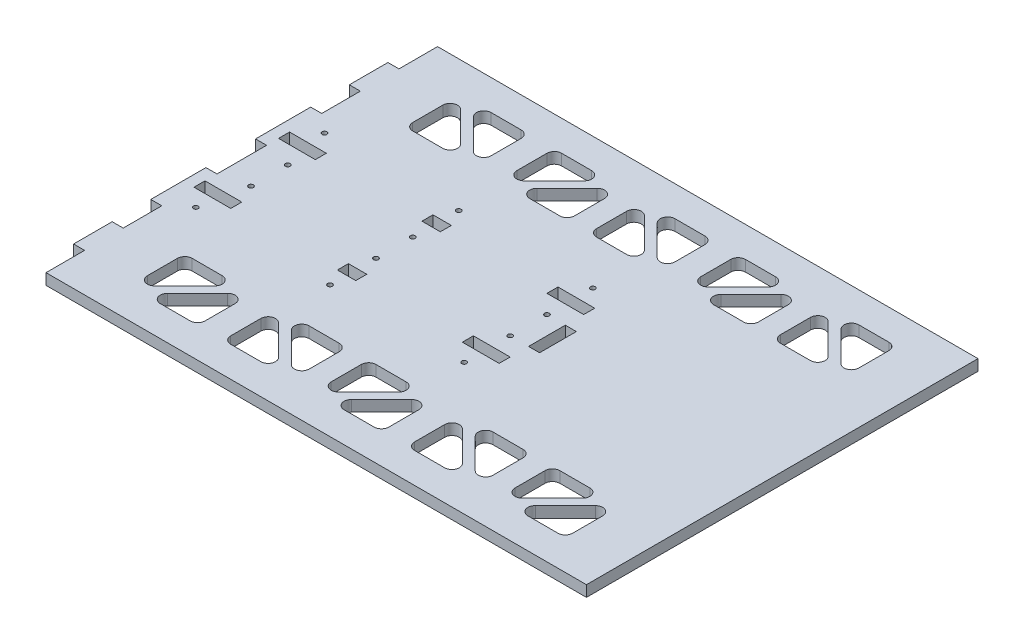
from build123d import *

# Parameters (mm, degrees)
SKETCH1_W            = 300
SKETCH1_H            = 213
BOSS_EXTRUDE1_DEPTH  = 6
SKETCH2_W            = 6
SKETCH2_H            = 21
CUT_EXTRUDE1_DEPTH   = 185.060452026
SKETCH3_W            = 20
SKETCH3_H            = 6
SKETCH3_W_2          = 10
CUT_EXTRUDE2_DEPTH   = 185.060452026
SKETCH4_W            = 6
SKETCH4_H            = 20
CUT_EXTRUDE3_DEPTH   = 185.060452026
SKETCH6_R            = 1.3
CUT_EXTRUDE4_DEPTH   = 185.060452026
CUT_EXTRUDE5_DEPTH   = 185.060452026
FILLET1_R            = 4
FILLET1_OF_MIRROR1_R = 4
SKETCH8_R            = 1.3
CUT_EXTRUDE6_DEPTH   = 185.060452026


with BuildPart() as part:
    # Sketch1 → Boss-Extrude1 (new body)
    with BuildSketch(Plane(origin=(0, 0, 0), x_dir=(1, 0, 0), z_dir=(0, 1, 0))):
        Rectangle(SKETCH1_W, SKETCH1_H)
    extrude(amount=BOSS_EXTRUDE1_DEPTH)

    # Sketch2 → Cut-Extrude1 (cut, through all)
    with BuildSketch(Plane(origin=(0, 6, 0), x_dir=(1, 0, 0), z_dir=(0, 1, 0))):
        with Locations((-147, 96)):
            Rectangle(SKETCH2_W, SKETCH2_H)
        Polygon((-150, -13.5), (-150, 0), (-150, 13.5), (-144, 13.5), (-144, -13.5), align=None)
        with Locations((-147, 54)):
            Rectangle(SKETCH2_W, SKETCH2_H)
        with Locations((-147, -54)):
            Rectangle(SKETCH2_W, SKETCH2_H)
        with Locations((-147, -96)):
            Rectangle(SKETCH2_W, SKETCH2_H)
    extrude(amount=-CUT_EXTRUDE1_DEPTH, mode=Mode.SUBTRACT)

    # Sketch3 → Cut-Extrude2 (cut, through all)
    with BuildSketch(Plane(origin=(0, 6, 0), x_dir=(1, 0, 0), z_dir=(0, 1, 0))):
        with Locations((-134, 23)):
            Rectangle(SKETCH3_W, SKETCH3_H)
        with Locations((-61, 23)):
            Rectangle(SKETCH3_W_2, SKETCH3_H)
        with Locations((12, 23)):
            Rectangle(SKETCH3_W, SKETCH3_H)
        with Locations((12, -23)):
            Rectangle(SKETCH3_W, SKETCH3_H)
        with Locations((-61, -23)):
            Rectangle(SKETCH3_W_2, SKETCH3_H)
        with Locations((-134, -23)):
            Rectangle(SKETCH3_W, SKETCH3_H)
    extrude(amount=-CUT_EXTRUDE2_DEPTH, mode=Mode.SUBTRACT)

    # Sketch4 → Cut-Extrude3 (cut, through all)
    with BuildSketch(Plane(origin=(0, 6, 0), x_dir=(1, 0, 0), z_dir=(0, 1, 0))):
        with Locations((25, 0)):
            Rectangle(SKETCH4_W, SKETCH4_H)
    extrude(amount=-CUT_EXTRUDE3_DEPTH, mode=Mode.SUBTRACT)

    # Sketch6 → Cut-Extrude4 (cut, through all)
    with BuildSketch(Plane(origin=(0, 6, 0), x_dir=(1, 0, 0), z_dir=(0, 1, 0))):
        with Locations((-134, 35)):
            Circle(SKETCH6_R)
        with Locations((-61, 35)):
            Circle(SKETCH6_R)
        with Locations((12, 35)):
            Circle(SKETCH6_R)
        with Locations((12, -35)):
            Circle(SKETCH6_R)
        with Locations((-61, -35)):
            Circle(SKETCH6_R)
        with Locations((-134, -35)):
            Circle(SKETCH6_R)
    extrude(amount=-CUT_EXTRUDE4_DEPTH, mode=Mode.SUBTRACT)

    # Sketch7 → Cut-Extrude5 (cut, through all)
    with BuildSketch(Plane(origin=(0, 6, 0), x_dir=(1, 0, 0), z_dir=(0, 1, 0))):
        Polygon((-115, 90), (-115, 60), (-85, 60), align=None)
        Polygon((-108, 90), (-78, 60), (-78, 90), align=None)
        Polygon((-64, 90), (-34, 90), (-64, 60), align=None)
        Polygon((-27, 60), (-57, 60), (-27, 90), align=None)
        Polygon((-15, 90), (-15, 60), (15, 60), align=None)
        Polygon((-8, 90), (22, 60), (22, 90), align=None)
        Polygon((36, 90), (66, 90), (36, 60), align=None)
        Polygon((73, 60), (43, 60), (73, 90), align=None)
        Polygon((85, 90), (85, 60), (115, 60), align=None)
        Polygon((92, 90), (122, 60), (122, 90), align=None)
    cut_extrude5 = extrude(amount=-CUT_EXTRUDE5_DEPTH, mode=Mode.SUBTRACT)

    # Fillet1
    fillet1_edges = [part.edges().sort_by_distance(p)[0] for p in [
        (92, 3, -90),
        (122, 3, -90),
        (122, 3, -60),
        (115, 3, -60),
        (85, 3, -90),
        (85, 3, -60),
        (73, 3, -60),
        (73, 3, -90),
        (43, 3, -60),
        (36, 3, -60),
        (66, 3, -90),
        (36, 3, -90),
        (-8, 3, -90),
        (22, 3, -90),
        (22, 3, -60),
        (-15, 3, -60),
        (15, 3, -60),
        (-15, 3, -90),
        (-57, 3, -60),
        (-27, 3, -60),
        (-27, 3, -90),
        (-34, 3, -90),
        (-64, 3, -90),
        (-64, 3, -60),
        (-78, 3, -60),
        (-78, 3, -90),
        (-108, 3, -90),
        (-115, 3, -60),
        (-85, 3, -60),
        (-115, 3, -90),
    ]]
    fillet(fillet1_edges, radius=FILLET1_R)

    # Mirror1: Cut-Extrude5 across plane
    add(cut_extrude5.mirror(Plane.XY), mode=Mode.SUBTRACT)

    # Fillet1 of Mirror1
    fillet1_of_mirror1_edges = [part.edges().sort_by_distance(p)[0] for p in [
        (92, 3, 90),
        (122, 3, 90),
        (122, 3, 60),
        (115, 3, 60),
        (85, 3, 90),
        (85, 3, 60),
        (73, 3, 60),
        (73, 3, 90),
        (43, 3, 60),
        (36, 3, 60),
        (66, 3, 90),
        (36, 3, 90),
        (-8, 3, 90),
        (22, 3, 90),
        (22, 3, 60),
        (-15, 3, 60),
        (15, 3, 60),
        (-15, 3, 90),
        (-57, 3, 60),
        (-27, 3, 60),
        (-27, 3, 90),
        (-34, 3, 90),
        (-64, 3, 90),
        (-64, 3, 60),
        (-78, 3, 60),
        (-78, 3, 90),
        (-108, 3, 90),
        (-115, 3, 60),
        (-85, 3, 60),
        (-115, 3, 90),
    ]]
    fillet(fillet1_of_mirror1_edges, radius=FILLET1_OF_MIRROR1_R)

    # Sketch8 → Cut-Extrude6 (cut, through all)
    with BuildSketch(Plane(origin=(0, 6, 0), x_dir=(1, 0, 0), z_dir=(0, 1, 0))):
        with Locations((-129, -10)):
            Circle(SKETCH8_R)
        with Locations((-61, -10)):
            Circle(SKETCH8_R)
        with Locations((12, -10)):
            Circle(SKETCH8_R)
        with Locations((-129, 10)):
            Circle(SKETCH8_R)
        with Locations((-61, 10)):
            Circle(SKETCH8_R)
        with Locations((12, 10)):
            Circle(SKETCH8_R)
    extrude(amount=-CUT_EXTRUDE6_DEPTH, mode=Mode.SUBTRACT)


solid = part.part
